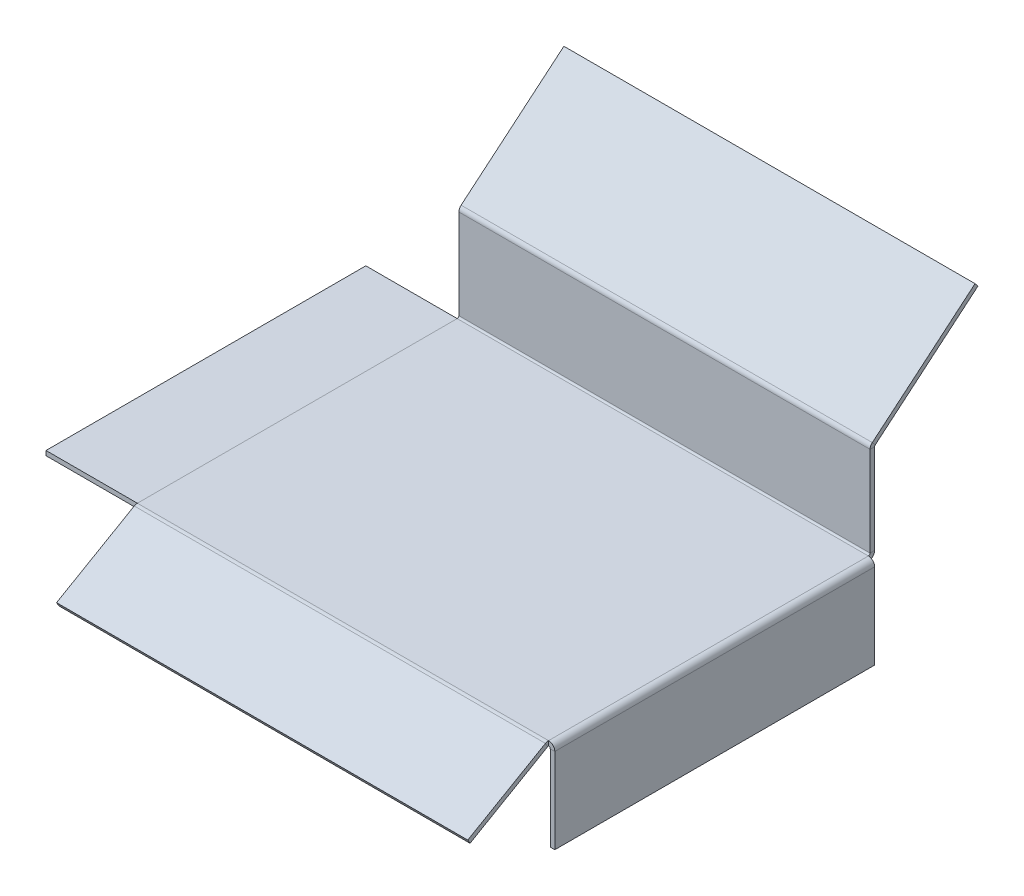
from build123d import *

# Parameters (mm, degrees)
SKETCH1_W            = 180
SKETCH1_H            = 140
BASE_FLANGE2_DEPTH   = 2
EDGE_FLANGE3_DEPTH   = 140
SKETCH19_W           = 140
SKETCH19_H           = 2
BOSS_EXTRUDE1_DEPTH  = 40
EDGE_FLANGE4_DEPTH   = 180
EDGE_FLANGE5_DEPTH   = 180
EDGE_FLANGE6_DEPTH   = 180
EDGE_FLANGE6_2_DEPTH = 180


# Read off the part's stored shape, not the designer's step: Edge-Flange6
# Sheet-metal steps are written as plain solids
with BuildPart() as part:
    # Sketch1 → Base-Flange2 (new body)
    with BuildSketch(Plane(origin=(0, 0, 0), x_dir=(1, 0, 0), z_dir=(0, 1, 0))):
        with Locations((90, 70)):
            Rectangle(SKETCH1_W, SKETCH1_H)
    extrude(amount=-BASE_FLANGE2_DEPTH)

    # Edge-Flange3 section (across the edge) → Edge-Flange3 (add)
    with BuildSketch(Plane(origin=(180.7366, -2, -140), x_dir=(-1, 0, 0), z_dir=(0, 0, 1))):
        with BuildLine():
            Line((-2, 0.7366), (-2, 38))
            Line((-2, 38), (0, 38))
            Line((0, 38), (0, 0.7366))
            ThreePointArc((0, 0.7366), (0.215745145, 0.215745145), (0.7366, 0))
            Line((0.7366, 0), (0.7366, -2))
            ThreePointArc((0.7366, -2), (-1.198468417, -1.198468417), (-2, 0.7366))
        make_face()
    extrude(amount=EDGE_FLANGE3_DEPTH)

    # Edge-Flange4 section (across the edge) → Edge-Flange4 (add)
    with BuildSketch(Plane(origin=(180, -2, 0.197371375), x_dir=(0, -0.8660254037844416, -0.49999999999999495), z_dir=(-1, 0, 0))):
        with BuildLine():
            Line((-2, 0.197371375), (-2, 39.464101615))
            Line((-2, 39.464101615), (0, 39.464101615))
            Line((0, 39.464101615), (0, 0.197371375))
            ThreePointArc((0, 0.197371375), (0.025099036, 0.006725267), (0.098685688, -0.170928625))
            Line((0.098685688, -0.170928625), (-1.63336512, -1.170928625))
            ThreePointArc((-1.63336512, -1.170928625), (-1.906752616, -0.510912824), (-2, 0.197371375))
        make_face()
    extrude(amount=EDGE_FLANGE4_DEPTH)

    # Edge-Flange5 section (across the edge) → Edge-Flange5 (add)
    with BuildSketch(Plane(origin=(180, 0, -140.7366), x_dir=(0, 0, 1), z_dir=(-1, 0, 0))):
        with BuildLine():
            Line((-2, 0.7366), (-2, 43))
            Line((-2, 43), (0, 43))
            Line((0, 43), (0, 0.7366))
            ThreePointArc((0, 0.7366), (0.215745145, 0.215745145), (0.7366, 0))
            Line((0.7366, 0), (0.7366, -2))
            ThreePointArc((0.7366, -2), (-1.198468417, -1.198468417), (-2, 0.7366))
        make_face()
    extrude(amount=EDGE_FLANGE5_DEPTH)

    # Edge-Flange6 outline → Edge-Flange6 (cut)
    with BuildSketch(Plane.YZ):
        with BuildLine():
            ThreePointArc((40.0457032, -140.7366), (41.202240335, -140.99299811), (42.142060423, -141.714147427))
            Line((42.142060423, -141.714147427), (43, -142.7366))
            Line((43, -142.7366), (43, -140.7366))
            Line((43, -140.7366), (40.0457032, -140.7366))
        make_face()
    extrude(amount=EDGE_FLANGE6_DEPTH, mode=Mode.SUBTRACT)

    # Edge-Flange6 2 outline → Edge-Flange6 2 (add)
    with BuildSketch(Plane.YZ):
        with BuildLine():
            Line((79.889057319, -186.699266587), (43, -142.7366))
            Line((43, -142.7366), (40.0457032, -142.7366))
            ThreePointArc((40.0457032, -142.7366), (40.357003812, -142.805613684), (40.609971537, -142.999722647))
            Line((40.609971537, -142.999722647), (78.356968433, -187.984841807))
            Line((78.356968433, -187.984841807), (79.889057319, -186.699266587))
        make_face()
    extrude(amount=EDGE_FLANGE6_2_DEPTH)


with BuildPart() as body_2:
    # Sketch19 → Boss-Extrude1 (new body)
    with BuildSketch(Plane.ZY):
        with Locations((-70, -1)):
            Rectangle(SKETCH19_W, SKETCH19_H)
    extrude(amount=BOSS_EXTRUDE1_DEPTH)


solid = Compound([part.part, body_2.part])
